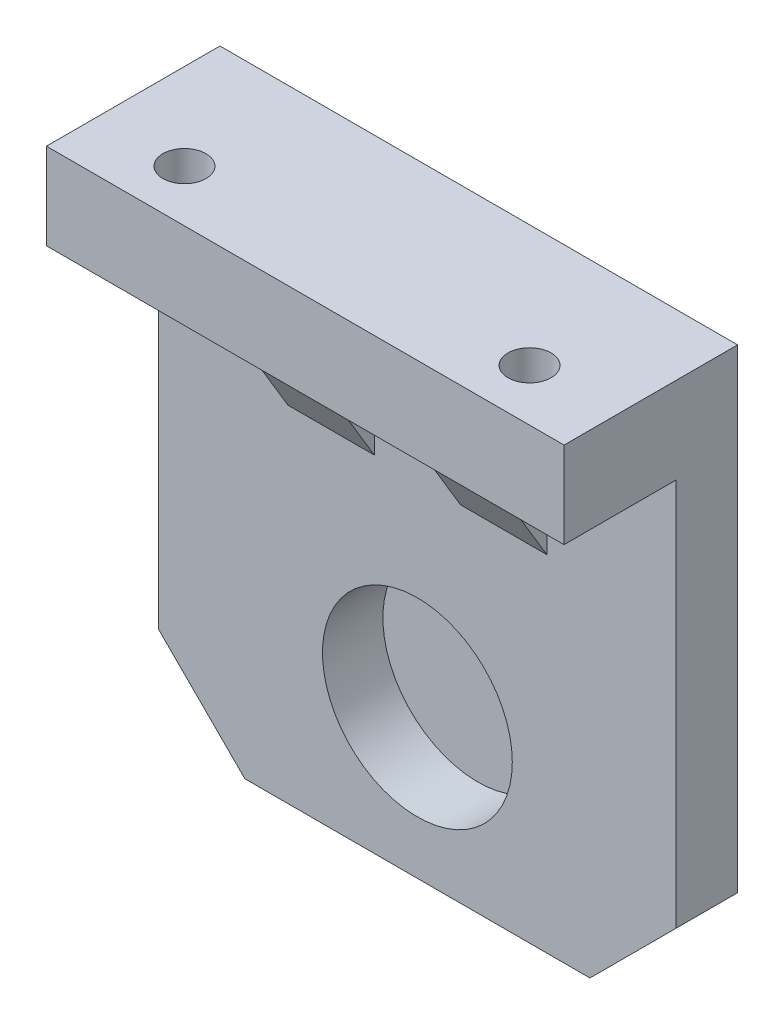
from build123d import *

# Parameters (mm, degrees)
SKETCH1_W           = 60
SKETCH1_H           = 65
BOSS_EXTRUDE1_DEPTH = 10
SKETCH6_W           = 60
SKETCH6_H           = 10
BOSS_EXTRUDE2_DEPTH = 23
CHAMFER1_SIZE       = 5
CHAMFER1_SIZE2      = 2.886751346
SKETCH5_R           = 11
CUT_EXTRUDE4_DEPTH  = 7
SKETCH12_R          = 2.5
CUT_EXTRUDE6_DEPTH  = 108.953693777
RIB1_REACH          = 81.712
SKETCH13_WALL_W     = 178.916818752
SKETCH13_WALL_H     = 10
CHAMFER3_START      = -1
CHAMFER3_DEPTH      = 24
SKETCH14_R          = 1.175
SKETCH14_R_2        = 1.25
CUT_EXTRUDE7_DEPTH  = 5


with BuildPart() as part:
    # Sketch1 → Boss-Extrude1 (new body)
    with BuildSketch(Plane.XY):
        with Locations((60, 32.5)):
            Rectangle(SKETCH1_W, SKETCH1_H)
    extrude(amount=BOSS_EXTRUDE1_DEPTH)

    # Sketch6 → Boss-Extrude2 (add)
    with BuildSketch(Plane(origin=(0, 0, 0), x_dir=(-1, 0, 0), z_dir=(0, 0, -1))):
        with Locations((-60, 60)):
            Rectangle(SKETCH6_W, SKETCH6_H)
    extrude(amount=-BOSS_EXTRUDE2_DEPTH)

    # Chamfer1
    chamfer1_edges = [part.edges().sort_by_distance(p)[0] for p in [
        (60, 65, 0),
        (90, 32.5, 0),
        (60, 0, 0),
        (30, 32.5, 0),
    ]]
    chamfer1_side = [part.faces().sort_by_distance(p)[0] for p in [
        (60, 32.5, 0),
    ]]
    chamfer(chamfer1_edges, length=CHAMFER1_SIZE, length2=CHAMFER1_SIZE2, reference=chamfer1_side[0])

    # Sketch5 → Cut-Extrude4 (cut)
    with BuildSketch(Plane.XY.offset(10)):
        with Locations((60, 17.17)):
            Circle(SKETCH5_R)
    extrude(amount=-CUT_EXTRUDE4_DEPTH, mode=Mode.SUBTRACT)

    # Sketch12 → Cut-Extrude6 (cut, through all)
    with BuildSketch(Plane(origin=(0, 55, 0), x_dir=(-1, 0, 0), z_dir=(0, -1, 0))):
        with Locations(Location((-80, -17, 0), (0, 0, 180))):
            Circle(SKETCH12_R)
        with Locations((-40, -17)):
            Circle(SKETCH12_R)
    extrude(amount=-CUT_EXTRUDE6_DEPTH, mode=Mode.SUBTRACT)

    # Sketch13 wall → Rib1 (add, up to next)
    with BuildSketch(Plane(origin=(50, 47.5, 14.5), x_dir=(0, -0.857492925713, -0.514495755428), z_dir=(0, 0.514495755428, -0.857492925713)), mode=Mode.PRIVATE) as rib1_sk1:
        Rectangle(SKETCH13_WALL_W, SKETCH13_WALL_H)
    rib1_tool1 = extrude(rib1_sk1.sketch, amount=RIB1_REACH, mode=Mode.PRIVATE) - part.part
    rib1 = rib1_tool1.solids().sort_by_distance((50, 47.5, 14.5))[0]
    add(rib1)

    # Mirror1: Rib1 across plane
    add(rib1.mirror(Plane(origin=(60, 0, 0), x_dir=(0, 0, 1), z_dir=(1, 0, 0))))

    # Chamfer3: read off the stored shape, not the designer's step
    # Chamfer3 outline → Chamfer3 (cut)
    with BuildSketch(Plane.XY.offset(CHAMFER3_START)):
        Polygon((90, 0), (90, 10), (80, 0), align=None)
        Polygon((30, 0), (40, 0), (30, 10), align=None)
    extrude(amount=CHAMFER3_DEPTH, mode=Mode.SUBTRACT)

    # Sketch14 → Cut-Extrude7 (cut)
    with BuildSketch(Plane.ZY.offset(-30)):
        with Locations((7.3, 24.6)):
            Circle(SKETCH14_R)
        with Locations((7.3, 15.1)):
            Circle(SKETCH14_R_2)
    extrude(amount=-CUT_EXTRUDE7_DEPTH, mode=Mode.SUBTRACT)


solid = part.part
